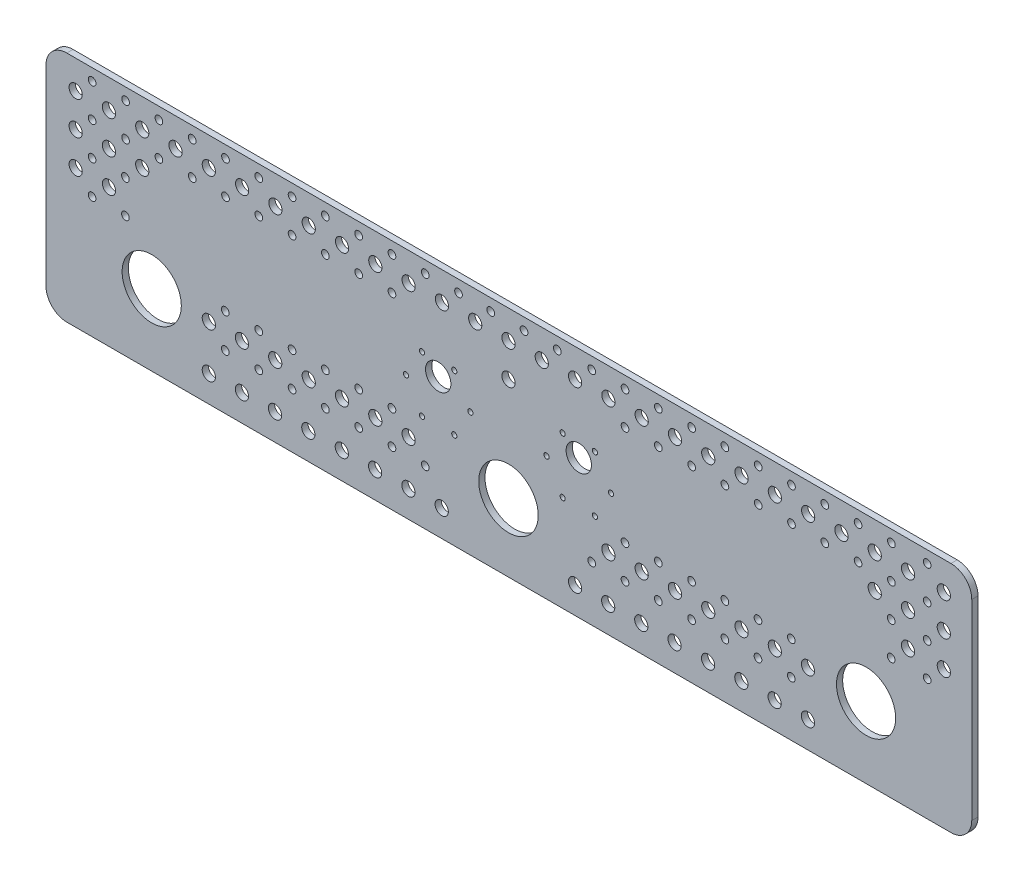
from build123d import *

# Parameters (mm, degrees)
SKETCH1_R           = 14.225
SKETCH1_R_2         = 14.3
SKETCH1_R_3         = 3.18
SKETCH1_R_4         = 1.85
SKETCH1_R_5         = 6.1
SKETCH1_R_6         = 1.25
BOSS_EXTRUDE5_DEPTH = 3


with BuildPart() as part:
    # Sketch1 → Boss-Extrude5 (new body)
    with BuildSketch(Plane.XY):
        with BuildLine():
            Line((-435.149770336, 91.084511017), (-10.273771909, 91.084511017))
            ThreePointArc((-10.273771909, 91.084511017), (-3.202704097, 88.155578829), (-0.273771909, 81.084511017))
            Line((-0.273771909, 81.084511017), (-0.273771909, -10.915488983))
            ThreePointArc((-0.273771909, -10.915488983), (-3.202704097, -17.986556794), (-10.273771909, -20.915488983))
            Line((-10.273771909, -20.915488983), (-435.149770336, -20.915488983))
            ThreePointArc((-435.149770336, -20.915488983), (-442.220838148, -17.986556794), (-445.149770336, -10.915488983))
            Line((-445.149770336, -10.915488983), (-445.149770336, 81.084511017))
            ThreePointArc((-445.149770336, 81.084511017), (-442.220838148, 88.155578829), (-435.149770336, 91.084511017))
        make_face()
        with Locations((-394.349770336, 13.384511017)):
            Circle(SKETCH1_R, mode=Mode.SUBTRACT)
        with Locations((-51.073771909, 13.384511017)):
            Circle(SKETCH1_R, mode=Mode.SUBTRACT)
        with Locations((-222.899770336, 11.884511017)):
            Circle(SKETCH1_R_2, mode=Mode.SUBTRACT)
        with Locations((-30.899770336, 61.384511017)):
            Circle(SKETCH1_R_3, mode=Mode.SUBTRACT)
        with Locations((-414.899770336, 61.384511017)):
            Circle(SKETCH1_R_3, mode=Mode.SUBTRACT)
        with Locations((-286.899770336, 13.384511017)):
            Circle(SKETCH1_R_3, mode=Mode.SUBTRACT)
        with Locations((-302.899770336, 13.384511017)):
            Circle(SKETCH1_R_3, mode=Mode.SUBTRACT)
        with Locations((-318.899770336, 13.384511017)):
            Circle(SKETCH1_R_3, mode=Mode.SUBTRACT)
        with Locations((-270.899770336, 13.384511017)):
            Circle(SKETCH1_R_3, mode=Mode.SUBTRACT)
        with Locations((-310.899770336, 5.384511017)):
            Circle(SKETCH1_R_4, mode=Mode.SUBTRACT)
        with Locations((-294.899770336, 5.384511017)):
            Circle(SKETCH1_R_4, mode=Mode.SUBTRACT)
        with Locations((-278.899770336, 5.384511017)):
            Circle(SKETCH1_R_4, mode=Mode.SUBTRACT)
        with Locations((-262.899770336, 5.384511017)):
            Circle(SKETCH1_R_4, mode=Mode.SUBTRACT)
        with Locations((-310.899770336, 21.384511017)):
            Circle(SKETCH1_R_4, mode=Mode.SUBTRACT)
        with Locations((-294.899770336, 21.384511017)):
            Circle(SKETCH1_R_4, mode=Mode.SUBTRACT)
        with Locations((-278.899770336, 21.384511017)):
            Circle(SKETCH1_R_4, mode=Mode.SUBTRACT)
        with Locations((-158.899770336, 13.384511017)):
            Circle(SKETCH1_R_3, mode=Mode.SUBTRACT)
        with Locations((-174.899770336, 13.384511017)):
            Circle(SKETCH1_R_3, mode=Mode.SUBTRACT)
        with Locations((-142.899770336, 13.384511017)):
            Circle(SKETCH1_R_3, mode=Mode.SUBTRACT)
        with Locations((-126.899770336, 13.384511017)):
            Circle(SKETCH1_R_3, mode=Mode.SUBTRACT)
        with Locations((-182.899770336, 5.384511017)):
            Circle(SKETCH1_R_4, mode=Mode.SUBTRACT)
        with Locations((-166.899770336, 5.384511017)):
            Circle(SKETCH1_R_4, mode=Mode.SUBTRACT)
        with Locations((-150.899770336, 5.384511017)):
            Circle(SKETCH1_R_4, mode=Mode.SUBTRACT)
        with Locations((-134.899770336, 5.384511017)):
            Circle(SKETCH1_R_4, mode=Mode.SUBTRACT)
        with Locations((-166.899770336, 21.384511017)):
            Circle(SKETCH1_R_4, mode=Mode.SUBTRACT)
        with Locations((-150.899770336, 21.384511017)):
            Circle(SKETCH1_R_4, mode=Mode.SUBTRACT)
        with Locations((-134.899770336, 21.384511017)):
            Circle(SKETCH1_R_4, mode=Mode.SUBTRACT)
        with Locations((-318.899770336, 77.384511017)):
            Circle(SKETCH1_R_3, mode=Mode.SUBTRACT)
        with Locations((-334.899770336, 77.384511017)):
            Circle(SKETCH1_R_3, mode=Mode.SUBTRACT)
        with Locations((-302.899770336, 77.384511017)):
            Circle(SKETCH1_R_3, mode=Mode.SUBTRACT)
        with Locations((-286.899770336, 77.384511017)):
            Circle(SKETCH1_R_3, mode=Mode.SUBTRACT)
        with Locations((-310.899770336, 69.384511017)):
            Circle(SKETCH1_R_4, mode=Mode.SUBTRACT)
        with Locations((-294.899770336, 69.384511017)):
            Circle(SKETCH1_R_4, mode=Mode.SUBTRACT)
        with Locations((-278.899770336, 69.384511017)):
            Circle(SKETCH1_R_4, mode=Mode.SUBTRACT)
        with Locations((-310.899770336, 85.384511017)):
            Circle(SKETCH1_R_4, mode=Mode.SUBTRACT)
        with Locations((-294.899770336, 85.384511017)):
            Circle(SKETCH1_R_4, mode=Mode.SUBTRACT)
        with Locations((-278.899770336, 85.384511017)):
            Circle(SKETCH1_R_4, mode=Mode.SUBTRACT)
        with Locations((-262.899770336, 85.384511017)):
            Circle(SKETCH1_R_4, mode=Mode.SUBTRACT)
        with Locations((-270.899770336, 77.384511017)):
            Circle(SKETCH1_R_3, mode=Mode.SUBTRACT)
        with Locations((-142.899770336, 77.384511017)):
            Circle(SKETCH1_R_3, mode=Mode.SUBTRACT)
        with Locations((-158.899770336, 77.384511017)):
            Circle(SKETCH1_R_3, mode=Mode.SUBTRACT)
        with Locations((-174.899770336, 77.384511017)):
            Circle(SKETCH1_R_3, mode=Mode.SUBTRACT)
        with Locations((-126.899770336, 77.384511017)):
            Circle(SKETCH1_R_3, mode=Mode.SUBTRACT)
        with Locations((-110.899770336, 77.384511017)):
            Circle(SKETCH1_R_3, mode=Mode.SUBTRACT)
        with Locations((-166.899770336, 69.384511017)):
            Circle(SKETCH1_R_4, mode=Mode.SUBTRACT)
        with Locations((-150.899770336, 69.384511017)):
            Circle(SKETCH1_R_4, mode=Mode.SUBTRACT)
        with Locations((-134.899770336, 69.384511017)):
            Circle(SKETCH1_R_4, mode=Mode.SUBTRACT)
        with Locations((-182.899770336, 85.384511017)):
            Circle(SKETCH1_R_4, mode=Mode.SUBTRACT)
        with Locations((-166.899770336, 85.384511017)):
            Circle(SKETCH1_R_4, mode=Mode.SUBTRACT)
        with Locations((-150.899770336, 85.384511017)):
            Circle(SKETCH1_R_4, mode=Mode.SUBTRACT)
        with Locations((-134.899770336, 85.384511017)):
            Circle(SKETCH1_R_4, mode=Mode.SUBTRACT)
        with Locations((-222.899770336, 77.384511017)):
            Circle(SKETCH1_R_3, mode=Mode.SUBTRACT)
        with Locations((-238.899770336, 77.384511017)):
            Circle(SKETCH1_R_3, mode=Mode.SUBTRACT)
        with Locations((-254.899770336, 77.384511017)):
            Circle(SKETCH1_R_3, mode=Mode.SUBTRACT)
        with Locations((-206.899770336, 77.384511017)):
            Circle(SKETCH1_R_3, mode=Mode.SUBTRACT)
        with Locations((-190.899770336, 77.384511017)):
            Circle(SKETCH1_R_3, mode=Mode.SUBTRACT)
        with Locations((-246.899770336, 85.384511017)):
            Circle(SKETCH1_R_4, mode=Mode.SUBTRACT)
        with Locations((-231.427182614, 85.384511017)):
            Circle(SKETCH1_R_4, mode=Mode.SUBTRACT)
        with Locations((-215.427182614, 85.384511017)):
            Circle(SKETCH1_R_4, mode=Mode.SUBTRACT)
        with Locations((-199.427182614, 85.384511017)):
            Circle(SKETCH1_R_4, mode=Mode.SUBTRACT)
        with Locations((-398.899770336, 77.384511017)):
            Circle(SKETCH1_R_3, mode=Mode.SUBTRACT)
        with Locations((-414.899770336, 77.384511017)):
            Circle(SKETCH1_R_3, mode=Mode.SUBTRACT)
        with Locations((-382.899770336, 77.384511017)):
            Circle(SKETCH1_R_3, mode=Mode.SUBTRACT)
        with Locations((-366.899770336, 77.384511017)):
            Circle(SKETCH1_R_3, mode=Mode.SUBTRACT)
        with Locations((-390.899770336, 69.384511017)):
            Circle(SKETCH1_R_4, mode=Mode.SUBTRACT)
        with Locations((-374.899770336, 69.384511017)):
            Circle(SKETCH1_R_4, mode=Mode.SUBTRACT)
        with Locations((-358.899770336, 69.384511017)):
            Circle(SKETCH1_R_4, mode=Mode.SUBTRACT)
        with Locations((-342.899770336, 69.384511017)):
            Circle(SKETCH1_R_4, mode=Mode.SUBTRACT)
        with Locations((-390.899770336, 85.384511017)):
            Circle(SKETCH1_R_4, mode=Mode.SUBTRACT)
        with Locations((-374.899770336, 85.384511017)):
            Circle(SKETCH1_R_4, mode=Mode.SUBTRACT)
        with Locations((-358.899770336, 85.384511017)):
            Circle(SKETCH1_R_4, mode=Mode.SUBTRACT)
        with Locations((-342.899770336, 85.384511017)):
            Circle(SKETCH1_R_4, mode=Mode.SUBTRACT)
        with Locations((-350.899770336, 77.384511017)):
            Circle(SKETCH1_R_3, mode=Mode.SUBTRACT)
        with Locations((-78.899770336, 77.384511017)):
            Circle(SKETCH1_R_3, mode=Mode.SUBTRACT)
        with Locations((-94.899770336, 77.384511017)):
            Circle(SKETCH1_R_3, mode=Mode.SUBTRACT)
        with Locations((-62.899770336, 77.384511017)):
            Circle(SKETCH1_R_3, mode=Mode.SUBTRACT)
        with Locations((-46.899770336, 77.384511017)):
            Circle(SKETCH1_R_3, mode=Mode.SUBTRACT)
        with Locations((-86.899770336, 69.384511017)):
            Circle(SKETCH1_R_4, mode=Mode.SUBTRACT)
        with Locations((-70.899770336, 69.384511017)):
            Circle(SKETCH1_R_4, mode=Mode.SUBTRACT)
        with Locations((-54.899770336, 69.384511017)):
            Circle(SKETCH1_R_4, mode=Mode.SUBTRACT)
        with Locations((-38.899770336, 69.384511017)):
            Circle(SKETCH1_R_4, mode=Mode.SUBTRACT)
        with Locations((-86.899770336, 85.384511017)):
            Circle(SKETCH1_R_4, mode=Mode.SUBTRACT)
        with Locations((-70.899770336, 85.384511017)):
            Circle(SKETCH1_R_4, mode=Mode.SUBTRACT)
        with Locations((-54.899770336, 85.384511017)):
            Circle(SKETCH1_R_4, mode=Mode.SUBTRACT)
        with Locations((-38.899770336, 85.384511017)):
            Circle(SKETCH1_R_4, mode=Mode.SUBTRACT)
        with Locations((-30.899770336, 77.384511017)):
            Circle(SKETCH1_R_3, mode=Mode.SUBTRACT)
        with Locations((-430.899770336, 77.384511017)):
            Circle(SKETCH1_R_3, mode=Mode.SUBTRACT)
        with Locations((-430.899770336, 61.384511017)):
            Circle(SKETCH1_R_3, mode=Mode.SUBTRACT)
        with Locations((-422.995687615, 69.384511017)):
            Circle(SKETCH1_R_4, mode=Mode.SUBTRACT)
        with Locations((-406.899770336, 69.384511017)):
            Circle(SKETCH1_R_4, mode=Mode.SUBTRACT)
        with Locations((-422.995687615, 85.384511017)):
            Circle(SKETCH1_R_4, mode=Mode.SUBTRACT)
        with Locations((-406.899770336, 85.384511017)):
            Circle(SKETCH1_R_4, mode=Mode.SUBTRACT)
        with Locations((-13.700814934, 61.384511017)):
            Circle(SKETCH1_R_3, mode=Mode.SUBTRACT)
        with Locations((-21.700814934, 69.384511017)):
            Circle(SKETCH1_R_4, mode=Mode.SUBTRACT)
        with Locations((-21.700814934, 85.384511017)):
            Circle(SKETCH1_R_4, mode=Mode.SUBTRACT)
        with Locations((-13.700814934, 77.384511017)):
            Circle(SKETCH1_R_3, mode=Mode.SUBTRACT)
        with Locations((-118.899770336, 69.384511017)):
            Circle(SKETCH1_R_4, mode=Mode.SUBTRACT)
        with Locations((-102.899770336, 69.384511017)):
            Circle(SKETCH1_R_4, mode=Mode.SUBTRACT)
        with Locations((-118.899770336, 85.384511017)):
            Circle(SKETCH1_R_4, mode=Mode.SUBTRACT)
        with Locations((-102.899770336, 85.384511017)):
            Circle(SKETCH1_R_4, mode=Mode.SUBTRACT)
        with Locations((-326.899770336, 69.384511017)):
            Circle(SKETCH1_R_4, mode=Mode.SUBTRACT)
        with Locations((-326.899770336, 85.384511017)):
            Circle(SKETCH1_R_4, mode=Mode.SUBTRACT)
        with Locations((-334.995687615, 13.384511017)):
            Circle(SKETCH1_R_3, mode=Mode.SUBTRACT)
        with Locations((-350.995687615, 13.384511017)):
            Circle(SKETCH1_R_3, mode=Mode.SUBTRACT)
        with Locations((-366.899770336, 13.384511017)):
            Circle(SKETCH1_R_3, mode=Mode.SUBTRACT)
        with Locations((-358.995687615, 5.384511017)):
            Circle(SKETCH1_R_4, mode=Mode.SUBTRACT)
        with Locations((-342.899770336, 5.384511017)):
            Circle(SKETCH1_R_4, mode=Mode.SUBTRACT)
        with Locations((-326.899770336, 5.384511017)):
            Circle(SKETCH1_R_4, mode=Mode.SUBTRACT)
        with Locations((-358.995687615, 21.719099167)):
            Circle(SKETCH1_R_4, mode=Mode.SUBTRACT)
        with Locations((-342.899770336, 21.719099167)):
            Circle(SKETCH1_R_4, mode=Mode.SUBTRACT)
        with Locations((-326.899770336, 21.719099167)):
            Circle(SKETCH1_R_4, mode=Mode.SUBTRACT)
        with Locations((-110.899770336, 13.384511017)):
            Circle(SKETCH1_R_3, mode=Mode.SUBTRACT)
        with Locations((-94.899770336, 13.384511017)):
            Circle(SKETCH1_R_3, mode=Mode.SUBTRACT)
        with Locations((-78.995687615, 13.384511017)):
            Circle(SKETCH1_R_3, mode=Mode.SUBTRACT)
        with Locations((-118.899770336, 5.384511017)):
            Circle(SKETCH1_R_4, mode=Mode.SUBTRACT)
        with Locations((-102.995687615, 5.384511017)):
            Circle(SKETCH1_R_4, mode=Mode.SUBTRACT)
        with Locations((-86.995687615, 5.384511017)):
            Circle(SKETCH1_R_4, mode=Mode.SUBTRACT)
        with Locations((-118.899770336, 21.384511017)):
            Circle(SKETCH1_R_4, mode=Mode.SUBTRACT)
        with Locations((-102.995687615, 21.384511017)):
            Circle(SKETCH1_R_4, mode=Mode.SUBTRACT)
        with Locations((-86.995687615, 21.384511017)):
            Circle(SKETCH1_R_4, mode=Mode.SUBTRACT)
        with Locations((-422.995687615, 37.384511017)):
            Circle(SKETCH1_R_4, mode=Mode.SUBTRACT)
        with Locations((-406.995687615, 37.384511017)):
            Circle(SKETCH1_R_4, mode=Mode.SUBTRACT)
        with Locations((-422.995687615, 53.384511017)):
            Circle(SKETCH1_R_4, mode=Mode.SUBTRACT)
        with Locations((-406.995687615, 53.384511017)):
            Circle(SKETCH1_R_4, mode=Mode.SUBTRACT)
        with Locations((-38.995687615, 37.384511017)):
            Circle(SKETCH1_R_4, mode=Mode.SUBTRACT)
        with Locations((-38.995687615, 53.384511017)):
            Circle(SKETCH1_R_4, mode=Mode.SUBTRACT)
        with Locations((-21.700814934, 37.384511017)):
            Circle(SKETCH1_R_4, mode=Mode.SUBTRACT)
        with Locations((-21.700814934, 53.384511017)):
            Circle(SKETCH1_R_4, mode=Mode.SUBTRACT)
        with Locations((-398.899770336, 61.384511017)):
            Circle(SKETCH1_R_3, mode=Mode.SUBTRACT)
        with Locations((-414.899770336, 45.384511017)):
            Circle(SKETCH1_R_3, mode=Mode.SUBTRACT)
        with Locations((-430.899770336, 45.384511017)):
            Circle(SKETCH1_R_3, mode=Mode.SUBTRACT)
        with Locations((-46.899770336, 61.384511017)):
            Circle(SKETCH1_R_3, mode=Mode.SUBTRACT)
        with Locations((-30.899770336, 45.384511017)):
            Circle(SKETCH1_R_3, mode=Mode.SUBTRACT)
        with Locations((-13.700814934, 45.384511017)):
            Circle(SKETCH1_R_3, mode=Mode.SUBTRACT)
        with Locations((-366.899770336, -8.175488983)):
            Circle(SKETCH1_R_3, mode=Mode.SUBTRACT)
        with Locations((-270.995687615, -8.175488983)):
            Circle(SKETCH1_R_3, mode=Mode.SUBTRACT)
        with Locations((-286.995687615, -8.175488983)):
            Circle(SKETCH1_R_3, mode=Mode.SUBTRACT)
        with Locations((-302.995687615, -8.175488983)):
            Circle(SKETCH1_R_3, mode=Mode.SUBTRACT)
        with Locations((-254.995687615, -8.175488983)):
            Circle(SKETCH1_R_3, mode=Mode.SUBTRACT)
        with Locations((-319.091604893, -8.175488983)):
            Circle(SKETCH1_R_3, mode=Mode.SUBTRACT)
        with Locations((-335.091604893, -8.175488983)):
            Circle(SKETCH1_R_3, mode=Mode.SUBTRACT)
        with Locations((-350.995687615, -8.175488983)):
            Circle(SKETCH1_R_3, mode=Mode.SUBTRACT)
        with Locations((-190.899770336, -8.175488983)):
            Circle(SKETCH1_R_3, mode=Mode.SUBTRACT)
        with Locations((-94.995687615, -8.175488983)):
            Circle(SKETCH1_R_3, mode=Mode.SUBTRACT)
        with Locations((-110.995687615, -8.175488983)):
            Circle(SKETCH1_R_3, mode=Mode.SUBTRACT)
        with Locations((-126.995687615, -8.175488983)):
            Circle(SKETCH1_R_3, mode=Mode.SUBTRACT)
        with Locations((-78.995687615, -8.175488983)):
            Circle(SKETCH1_R_3, mode=Mode.SUBTRACT)
        with Locations((-143.091604893, -8.175488983)):
            Circle(SKETCH1_R_3, mode=Mode.SUBTRACT)
        with Locations((-159.091604893, -8.175488983)):
            Circle(SKETCH1_R_3, mode=Mode.SUBTRACT)
        with Locations((-174.995687615, -8.175488983)):
            Circle(SKETCH1_R_3, mode=Mode.SUBTRACT)
        with Locations((-189.117770336, 45.666511017)):
            Circle(SKETCH1_R_5, mode=Mode.SUBTRACT)
        with Locations((-256.681770336, 45.666511017)):
            Circle(SKETCH1_R_5, mode=Mode.SUBTRACT)
        with Locations((-264.431770336, 52.089904776)):
            Circle(SKETCH1_R_6, mode=Mode.SUBTRACT)
        with Locations((-248.931770336, 52.089904776)):
            Circle(SKETCH1_R_6, mode=Mode.SUBTRACT)
        with Locations((-241.181770336, 38.666511017)):
            Circle(SKETCH1_R_6, mode=Mode.SUBTRACT)
        with Locations((-248.931770336, 25.243117259)):
            Circle(SKETCH1_R_6, mode=Mode.SUBTRACT)
        with Locations((-264.431770336, 25.243117259)):
            Circle(SKETCH1_R_6, mode=Mode.SUBTRACT)
        with Locations((-272.181770336, 38.666511017)):
            Circle(SKETCH1_R_6, mode=Mode.SUBTRACT)
        with Locations((-181.367770336, 25.243117259)):
            Circle(SKETCH1_R_6, mode=Mode.SUBTRACT)
        with Locations((-173.617770336, 38.666511017)):
            Circle(SKETCH1_R_6, mode=Mode.SUBTRACT)
        with Locations((-181.367770336, 52.089904776)):
            Circle(SKETCH1_R_6, mode=Mode.SUBTRACT)
        with Locations((-196.867770336, 52.089904776)):
            Circle(SKETCH1_R_6, mode=Mode.SUBTRACT)
        with Locations((-204.617770336, 38.666511017)):
            Circle(SKETCH1_R_6, mode=Mode.SUBTRACT)
        with Locations((-196.867770336, 25.243117259)):
            Circle(SKETCH1_R_6, mode=Mode.SUBTRACT)
        with Locations((-222.899770336, 61.384511017)):
            Circle(SKETCH1_R_3, mode=Mode.SUBTRACT)
    extrude(amount=BOSS_EXTRUDE5_DEPTH)


solid = part.part
